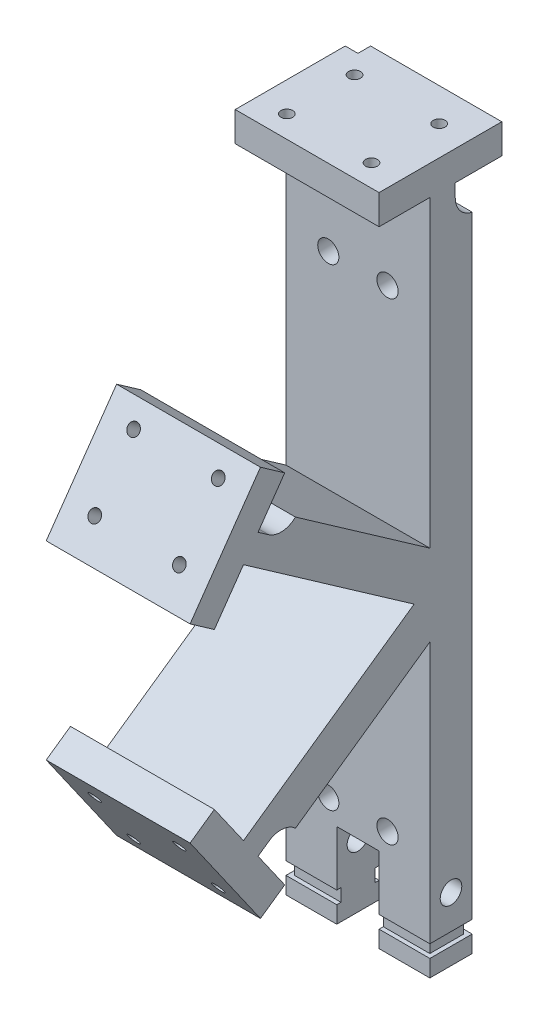
from build123d import *

# Parameters (mm, degrees)
SKETCH2_W                = 147.5
SKETCH2_H                = 176.75
BOSS_EXTRUDE1_DEPTH      = 10
SKETCH3_W                = 29
SKETCH3_H                = 15
BOSS_EXTRUDE2_DEPTH      = 34
BOSS_EXTRUDE3_DEPTH      = 34
SKETCH8_W                = 113.5
SKETCH8_H                = 176.75
CUT_EXTRUDE1_DEPTH       = 30
SKETCH9_R                = 2.5
CUT_EXTRUDE2_DEPTH       = 134.016415209
SKETCH10_W               = 3
SKETCH10_H               = 3
CUT_EXTRUDE3_DEPTH       = 3
CUT_EXTRUDE8_DEPTH       = 40
CUT_EXTRUDE8_DEPTH_BACK  = 40
SKETCH11_W               = 10
SKETCH11_H               = 4
SKETCH11_H_2             = 8
SKETCH11_H_3             = 3
SKETCH14_R               = 2.55
CUT_EXTRUDE9_DEPTH       = 40
CUT_EXTRUDE10_DEPTH      = 190.85860157
CUT_EXTRUDE10_DEPTH_BACK = 10
SKETCH15_R               = 1.4
SKETCH16_W               = 12
SKETCH16_H               = 8
CUT_EXTRUDE11_DEPTH      = 116.802867905
FILLET1_R                = 5
SKETCH17_R               = 1.4
CUT_EXTRUDE12_DEPTH      = 10
SKETCH18_R               = 1.4
CUT_EXTRUDE13_DEPTH      = 10
CUT_EXTRUDE14_DEPTH      = 34
FILLET2_R                = 5
SKETCH21_W               = 12
SKETCH21_H               = 10
BOSS_EXTRUDE4_DEPTH      = 5
SKETCH22_W               = 10
SKETCH22_H               = 3
CUT_EXTRUDE15_DEPTH      = 1
SKETCH23_W               = 11
SKETCH23_H               = 3
CUT_EXTRUDE16_DEPTH      = 1
SKETCH24_W               = 32
SKETCH24_H               = 3
CUT_EXTRUDE17_DEPTH      = 1


with BuildPart() as part:
    # Sketch2 → Boss-Extrude1 (new body)
    with BuildSketch(Plane.XY):
        Rectangle(SKETCH2_W, SKETCH2_H)
    extrude(amount=BOSS_EXTRUDE1_DEPTH)

    # Sketch3 → Boss-Extrude2 (add)
    with BuildSketch(Plane.ZY.offset(73.75)):
        with Locations((7.5, 80.875)):
            Rectangle(SKETCH3_W, SKETCH3_H)
        with Locations((7.5, -80.875)):
            Rectangle(SKETCH3_W, SKETCH3_H)
    boss_extrude2 = extrude(amount=-BOSS_EXTRUDE2_DEPTH)

    # Mirror1: Boss-Extrude2 across plane
    add(boss_extrude2.mirror(Plane(origin=(0, 0, 0), x_dir=(0, 0, 1), z_dir=(1, 0, 0))))

    # Sketch5 → Boss-Extrude3 (add)
    with BuildSketch(Plane.ZY.offset(73.75)):
        Polygon((13.717233978, 0), (47.494362324, 23.650999887), (54.37727956, 13.821175356), (66.664560225, 22.424821901), (50.030843571, 46.180231185), (37.743562906, 37.57658464), (41.758597961, 31.84252033), (10, 9.604910635), (10, -9.604910635), (41.758597961, -31.84252033), (37.743562906, -37.57658464), (50.030843571, -46.180231185), (66.664560225, -22.424821901), (54.37727956, -13.821175356), (47.494362324, -23.650999887), align=None)
    extrude(amount=-BOSS_EXTRUDE3_DEPTH)

    # Sketch8 → Cut-Extrude1 (cut)
    with BuildSketch(Plane.XY.offset(22)):
        with Locations((17, 0)):
            Rectangle(SKETCH8_W, SKETCH8_H)
    extrude(amount=-CUT_EXTRUDE1_DEPTH, mode=Mode.SUBTRACT)

    # Sketch9 → Cut-Extrude2 (cut, through all)
    with BuildSketch(Plane(origin=(0, 0, 0), x_dir=(-1, 0, 0), z_dir=(0, 0, -1))):
        with Locations((49.75, 58.375)):
            Circle(SKETCH9_R)
        with Locations((63.75, 58.375)):
            Circle(SKETCH9_R)
        with Locations((49.75, -53.375)):
            Circle(SKETCH9_R)
        with Locations((63.75, -53.375)):
            Circle(SKETCH9_R)
    extrude(amount=-CUT_EXTRUDE2_DEPTH, mode=Mode.SUBTRACT)

    # Sketch10 → Cut-Extrude3 (cut)
    with BuildSketch(Plane(origin=(0, 0, -7), x_dir=(-1, 0, 0), z_dir=(0, 0, -1))):
        with Locations((72.25, 86.875)):
            Rectangle(SKETCH10_W, SKETCH10_H)
    extrude(amount=-CUT_EXTRUDE3_DEPTH, mode=Mode.SUBTRACT)

    # Sketch11 → Cut-Extrude8 (cut, two sides: drawn at the far end of the back side and taken through both)
    with BuildSketch(Plane(origin=(0, 0, 0), x_dir=(-1, 0, 0), z_dir=(0, 0, -1)).offset(-CUT_EXTRUDE8_DEPTH_BACK)):
        with Locations((56.75, -63.375)):
            Rectangle(SKETCH11_W, SKETCH11_H)
        with Locations((56.75, -69.375)):
            Rectangle(SKETCH11_W, SKETCH11_H_2)
        with Locations((56.75, -59.875)):
            Rectangle(SKETCH11_W, SKETCH11_H_3)
        Polygon((42.75, -73.375), (39.75, -73.375), (39.75, -88.375), (73.75, -88.375), (73.75, -73.375), (70.75, -73.375), (61.75, -73.375), (51.75, -73.375), align=None)
    extrude(amount=CUT_EXTRUDE8_DEPTH + CUT_EXTRUDE8_DEPTH_BACK, mode=Mode.SUBTRACT)

    # Sketch14 → Cut-Extrude9 (cut)
    with BuildSketch(Plane.ZY.offset(73.75)):
        with Locations(Location((5, -63.375, 0), (0, 0, 270))):
            Circle(SKETCH14_R)
    extrude(amount=-CUT_EXTRUDE9_DEPTH, mode=Mode.SUBTRACT)

    # Sketch15 → Cut-Extrude10 (cut, two sides: drawn at the far end of the back side and taken through both)
    with BuildSketch(Plane(origin=(0, 88.375, 0), x_dir=(1, 0, 0), z_dir=(0, 1, 0)).offset(-CUT_EXTRUDE10_DEPTH_BACK)):
        with Locations(Location((-46.75, -16.8, 0), (0, 0, 90))):
            Circle(SKETCH15_R)
        with Locations(Location((-66.75, -16.8, 0), (0, 0, 90))):
            Circle(SKETCH15_R)
        with Locations(Location((-66.75, -0.8, 0), (0, 0, 90))):
            Circle(SKETCH15_R)
        with Locations(Location((-46.75, -0.8, 0), (0, 0, 90))):
            Circle(SKETCH15_R)
    extrude(amount=CUT_EXTRUDE10_DEPTH + CUT_EXTRUDE10_DEPTH_BACK, mode=Mode.SUBTRACT)

    # Sketch16 → Cut-Extrude11 (cut, through all)
    with BuildSketch(Plane.ZY.offset(73.75)):
        Polygon((-7, 73.375), (0, 73.375), (4, 73.375), (4, 81.375), (-7, 81.375), (-7, 79.375), align=None)
        with Locations((16, 77.375)):
            Rectangle(SKETCH16_W, SKETCH16_H)
    extrude(amount=-CUT_EXTRUDE11_DEPTH, mode=Mode.SUBTRACT)

    # Fillet1
    # the kernel refuses this fillet: 5 mm, written as the material it adds along each edge
    with BuildSketch(Plane(origin=(-73.75, 73.375, 4), x_dir=(0, 1, 0), z_dir=(1, 0, 0))) as fillet1_piece_1:
        with BuildLine():
            CenterArc((4.898979486, -5), FILLET1_R, 90, 78.463040967)
            Line((0, -4), (-0.09797959, -3.98))
            ThreePointArc((-0.09797959, -3.98), (-0.1, -2), (-0.1, 0))
            Line((-0.1, 0), (0, 0.1))
            Line((0, 0.1), (4.898979486, 0.1))
            Line((4.898979486, 0.1), (4.898979486, 0))
        make_face()
    extrude(amount=34)

    # Sketch17 → Cut-Extrude12 (cut)
    with BuildSketch(Plane(origin=(0, 38.699638206, 55.268811165), x_dir=(1, 0, 0), z_dir=(0, 0.5735764363510447, 0.8191520442889927))):
        with Locations(Location((-66.75, 3.932117818, 0), (0, 0, 270))):
            Circle(SKETCH17_R)
        with Locations(Location((-46.75, 3.932117818, 0), (0, 0, 270))):
            Circle(SKETCH17_R)
        with Locations(Location((-46.75, -12.067882182, 0), (0, 0, 270))):
            Circle(SKETCH17_R)
        with Locations(Location((-66.75, -12.067882182, 0), (0, 0, 270))):
            Circle(SKETCH17_R)
    extrude(amount=-CUT_EXTRUDE12_DEPTH, mode=Mode.SUBTRACT)

    # Sketch18 → Cut-Extrude13 (cut)
    with BuildSketch(Plane(origin=(0, -38.699638206, 55.268811165), x_dir=(1, 0, 0), z_dir=(0, -0.5735764363510447, 0.8191520442889929))):
        with Locations(Location((-46.75, -3.932117818, 0), (0, 0, 270))):
            Circle(SKETCH18_R)
        with Locations(Location((-66.75, -3.932117818, 0), (0, 0, 270))):
            Circle(SKETCH18_R)
        with Locations(Location((-66.75, 12.067882182, 0), (0, 0, 270))):
            Circle(SKETCH18_R)
        with Locations(Location((-46.75, 12.067882182, 0), (0, 0, 270))):
            Circle(SKETCH18_R)
    extrude(amount=-CUT_EXTRUDE13_DEPTH, mode=Mode.SUBTRACT)

    # Sketch20 → Cut-Extrude14 (cut)
    with BuildSketch(Plane.ZY.offset(73.75)):
        Polygon((37.743562906, 37.57658464), (41.758597961, 31.84252033), (44.052903706, 28.565912153), (50.60612006, 33.154523644), (44.296779261, 42.165196131), align=None)
        Polygon((47.494362324, 23.650999887), (54.37727956, 13.821175356), (60.930495915, 18.409786846), (54.047578679, 28.239611378), align=None)
        Polygon((54.047578679, -28.239611378), (47.494362324, -23.650999887), (54.37727956, -13.821175356), (60.930495915, -18.409786846), align=None)
        Polygon((50.60612006, -33.154523644), (44.052903706, -28.565912153), (41.758597961, -31.84252033), (37.743562906, -37.57658464), (44.296779261, -42.165196131), align=None)
    extrude(amount=-CUT_EXTRUDE14_DEPTH, mode=Mode.SUBTRACT)

    # Fillet2
    # the kernel refuses this fillet: 5 mm, written as the material it adds along each edge
    with BuildSketch(Plane(origin=(-73.75, -28.565912153, 44.052903706), x_dir=(0, -0.573576436351048, 0.8191520442889905), z_dir=(1, 0, 0))) as fillet2_piece_1:
        with BuildLine():
            CenterArc((4.898979486, 5), FILLET2_R, 191.536959033, 78.463040967)
            Line((0, 4), (-0.09797959, 3.98))
            ThreePointArc((-0.09797959, 3.98), (-0.1, 2), (-0.1, 0))
            Line((-0.1, 0), (0, -0.1))
            Line((0, -0.1), (4.898979486, -0.1))
            Line((4.898979486, -0.1), (4.898979486, 0))
        make_face()
    extrude(amount=34)
    with BuildSketch(Plane(origin=(-73.75, 28.565912153, 44.052903706), x_dir=(0, 0.8191520442898972, -0.5735764363497533), z_dir=(1, 0, 0))) as fillet2_piece_2:
        with BuildLine():
            CenterArc((5, 4.898979486), FILLET2_R, 180, 78.463040967)
            Line((0, 4.898979486), (-0.1, 4.898979486))
            Line((-0.1, 4.898979486), (-0.1, 0))
            Line((-0.1, 0), (0, -0.1))
            ThreePointArc((0, -0.1), (2, -0.1), (3.98, -0.09797959))
            Line((3.98, -0.09797959), (4, 0))
        make_face()
    extrude(amount=34)

    # Sketch21 → Boss-Extrude4 (add)
    with BuildSketch(Plane.XZ.offset(73.375)):
        with Locations((-67.75, 5)):
            Rectangle(SKETCH21_W, SKETCH21_H)
        with Locations((-45.75, 5)):
            Rectangle(SKETCH21_W, SKETCH21_H)
    extrude(amount=BOSS_EXTRUDE4_DEPTH)

    # Sketch22 → Cut-Extrude15 (cut)
    with BuildSketch(Plane.ZY.offset(73.75)):
        with Locations((5, -72.875)):
            Rectangle(SKETCH22_W, SKETCH22_H)
    cut_extrude15 = extrude(amount=-CUT_EXTRUDE15_DEPTH, mode=Mode.SUBTRACT)

    # Mirror2: Cut-Extrude15 across plane
    add(cut_extrude15.mirror(Plane.ZY.offset(56.75)), mode=Mode.SUBTRACT)

    # Sketch23 → Cut-Extrude16 (cut)
    with BuildSketch(Plane(origin=(0, 0, 0), x_dir=(-1, 0, 0), z_dir=(0, 0, -1))):
        with Locations((67.25, -72.875)):
            Rectangle(SKETCH23_W, SKETCH23_H)
        with Locations((46.25, -72.875)):
            Rectangle(SKETCH23_W, SKETCH23_H)
    extrude(amount=-CUT_EXTRUDE16_DEPTH, mode=Mode.SUBTRACT)

    # Sketch24 → Cut-Extrude17 (cut)
    with BuildSketch(Plane.XY.offset(10)):
        with Locations((-56.75, -72.875)):
            Rectangle(SKETCH24_W, SKETCH24_H)
    extrude(amount=-CUT_EXTRUDE17_DEPTH, mode=Mode.SUBTRACT)


solid = part.part
